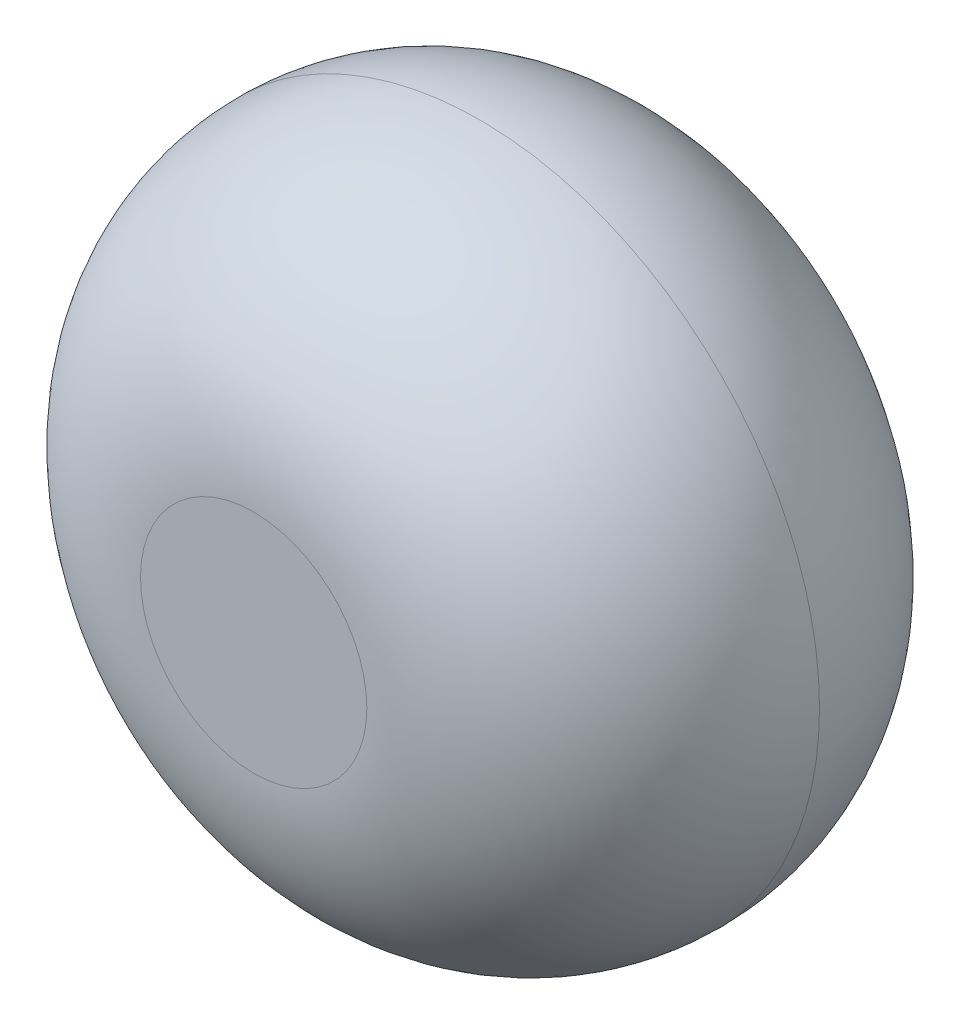
from build123d import *

# Parameters (mm, degrees)
ESQUISSE1_R        = 38.1
BOSS_EXTRU_1_DEPTH = 50.8
CONG_1_R           = 25.4


with BuildPart() as part:
    # Esquisse1 → Boss.-Extru.1 (new body)
    with BuildSketch(Plane.XY):
        Circle(ESQUISSE1_R)
    extrude(amount=BOSS_EXTRU_1_DEPTH)

    # Congé1
    cong_1_edges = [part.edges().sort_by_distance(p)[0] for p in [
        (-38.1, 0, 0),
        (-38.1, 0, 50.8),
    ]]
    fillet(cong_1_edges, radius=CONG_1_R - 0.0001)  # a hair under: the kernel refuses the full size


solid = part.part
